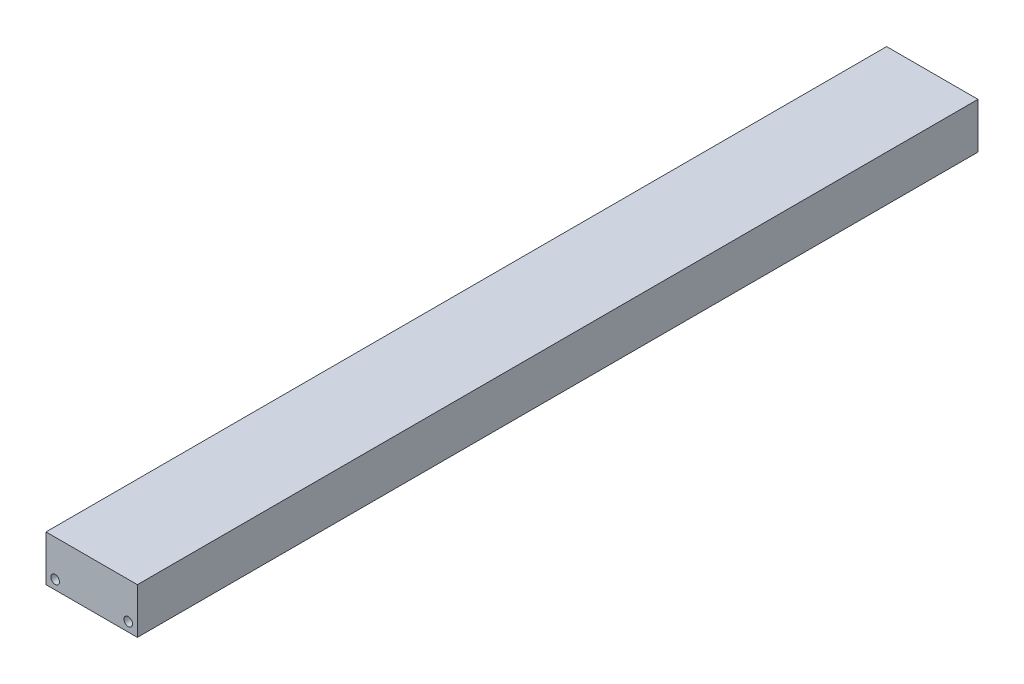
from build123d import *

# Parameters (mm, degrees)
SKETCH1_W           = 63.5
SKETCH1_H           = 63.5
SKETCH1_R           = 3
BOSS_EXTRUDE1_DEPTH = 292.1
SKETCH3_W           = 63.5
SKETCH3_H           = 31.75
CUT_EXTRUDE2_DEPTH  = 586.923002621


with BuildPart() as part:
    # Sketch1 → Boss-Extrude1 (new, symmetric)
    with BuildSketch(Plane.XY):
        Rectangle(SKETCH1_W, SKETCH1_H)
        with Locations((-25.4, 25.4)):
            Circle(SKETCH1_R, mode=Mode.SUBTRACT)
        with Locations((25.4, -25.4)):
            Circle(SKETCH1_R, mode=Mode.SUBTRACT)
        with Locations((-25.4, -25.4)):
            Circle(SKETCH1_R, mode=Mode.SUBTRACT)
        with Locations((25.4, 25.4)):
            Circle(SKETCH1_R, mode=Mode.SUBTRACT)
    extrude(amount=BOSS_EXTRUDE1_DEPTH, both=True)

    # Sketch3 → Cut-Extrude2 (cut, through all)
    with BuildSketch(Plane.XY.offset(292.1)):
        with Locations((0, 15.875)):
            Rectangle(SKETCH3_W, SKETCH3_H)
    extrude(amount=-CUT_EXTRUDE2_DEPTH, mode=Mode.SUBTRACT)


solid = part.part
